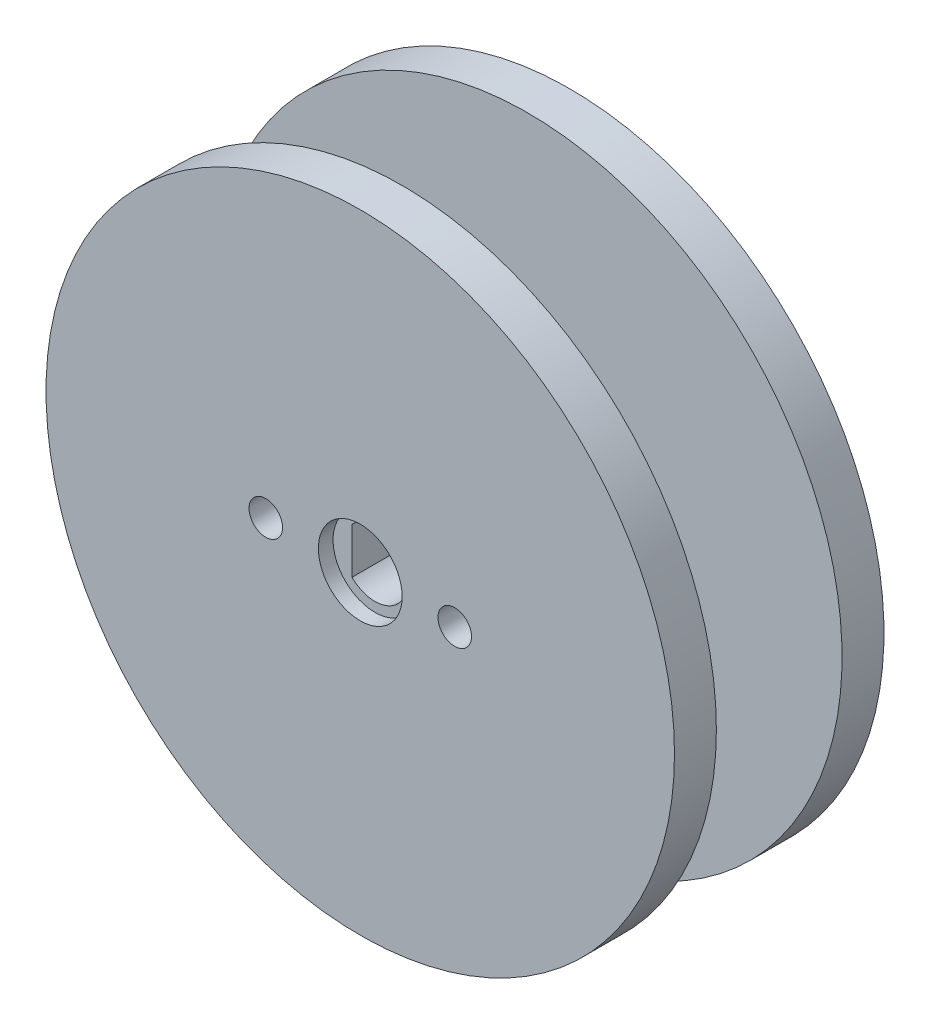
from build123d import *

# Parameters (mm, degrees)
SKETCH1_R           = 2.5
BOSS_EXTRUDE1_DEPTH = 6
SKETCH2_R           = 15
BOSS_EXTRUDE2_DEPTH = 2
BOSS_EXTRUDE3_START = 2
SKETCH3_R           = 15
BOSS_EXTRUDE3_DEPTH = 2
FILLET9_R           = 3
FILLET10_R          = 3
CUT_EXTRUDE1_DEPTH  = 10
SKETCH5_R           = 1.999371682
CUT_EXTRUDE2_DEPTH  = 0.7
SKETCH7_R           = 0.8
CUT_EXTRUDE6_DEPTH  = 3
SKETCH8_R           = 0.8
CUT_EXTRUDE7_DEPTH  = 5


with BuildPart() as part:
    # Sketch1 → Boss-Extrude1 (new body)
    with BuildSketch(Plane.XY):
        Circle(SKETCH1_R)
    extrude(amount=BOSS_EXTRUDE1_DEPTH)

    # Sketch2 → Boss-Extrude2 (add)
    with BuildSketch(Plane(origin=(0, 0, 0), x_dir=(-1, 0, 0), z_dir=(0, 0, -1))):
        Circle(SKETCH2_R)
    extrude(amount=BOSS_EXTRUDE2_DEPTH)

    # Sketch3 → Boss-Extrude3 (add)
    with BuildSketch(Plane.XY.offset(6).offset(BOSS_EXTRUDE3_START)):
        with Locations(Location((0, 0, 0), (0, 0, 180))):
            Circle(SKETCH3_R)
    extrude(amount=-BOSS_EXTRUDE3_DEPTH)

    # Fillet9
    fillet9_edges = [part.edges().sort_by_distance(p)[0] for p in [
        (-2.5, 0, 0),
    ]]
    fillet(fillet9_edges, radius=FILLET9_R)

    # Fillet10
    fillet10_edges = [part.edges().sort_by_distance(p)[0] for p in [
        (-2.5, 0, 6),
    ]]
    fillet(fillet10_edges, radius=FILLET10_R - 0.0001)  # a hair under: the kernel refuses the full size

    # Sketch4 → Cut-Extrude1 (cut)
    with BuildSketch(Plane(origin=(0, 0, -2), x_dir=(-1, 0, 0), z_dir=(0, 0, -1))):
        with BuildLine():
            Line((1.095333333, 1.096697264), (1.095333333, -1.096697264))
            ThreePointArc((1.095333333, -1.096697264), (-1.55, 0), (1.095333333, 1.096697264))
        make_face()
    extrude(amount=-CUT_EXTRUDE1_DEPTH, mode=Mode.SUBTRACT)

    # Sketch5 → Cut-Extrude2 (cut)
    with BuildSketch(Plane.XY.offset(8)):
        Circle(SKETCH5_R)
    extrude(amount=-CUT_EXTRUDE2_DEPTH, mode=Mode.SUBTRACT)

    # Sketch7 → Cut-Extrude6 (cut)
    with BuildSketch(Plane.XY.offset(8)):
        with Locations((4.509371682, 0)):
            Circle(SKETCH7_R)
        with Locations((-4.509371682, 0)):
            Circle(SKETCH7_R)
    extrude(amount=-CUT_EXTRUDE6_DEPTH, mode=Mode.SUBTRACT)

    # Sketch8 → Cut-Extrude7 (cut)
    with BuildSketch(Plane(origin=(0, 0, -2), x_dir=(-1, 0, 0), z_dir=(0, 0, -1))):
        with Locations((-4.5, 0)):
            Circle(SKETCH8_R)
        with Locations((4.5, 0)):
            Circle(SKETCH8_R)
    extrude(amount=-CUT_EXTRUDE7_DEPTH, mode=Mode.SUBTRACT)


solid = part.part
